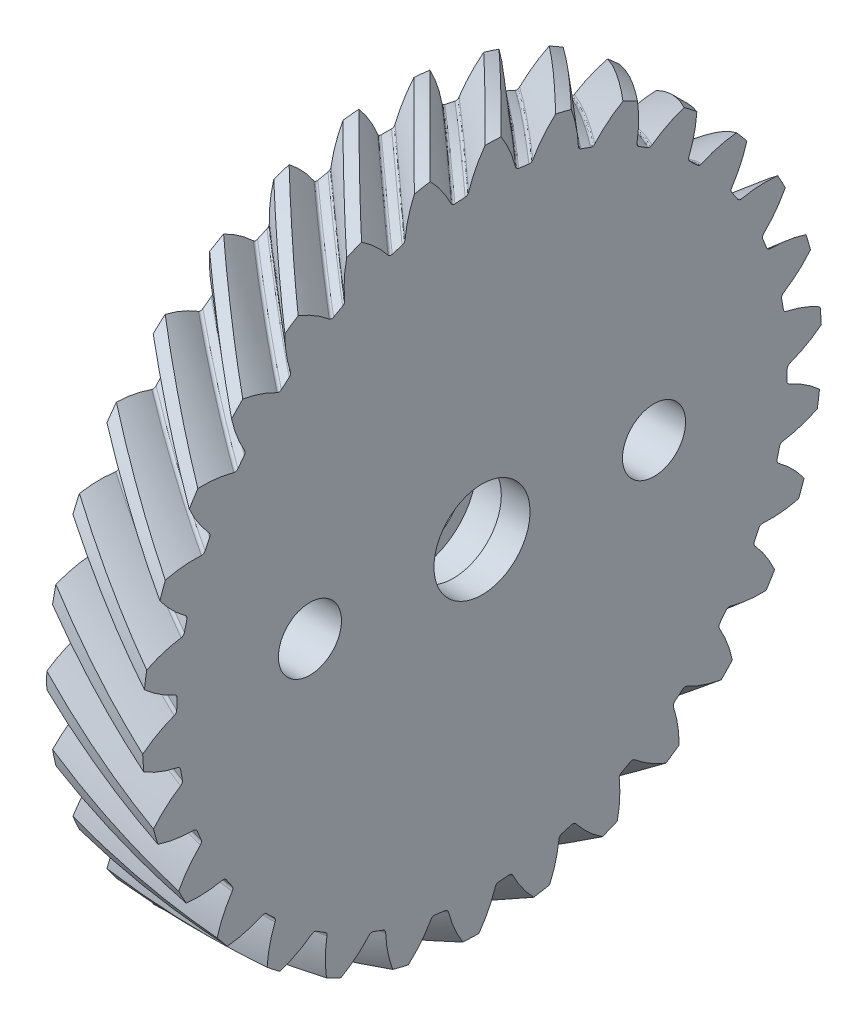
from build123d import *

# Parameters (mm, degrees)
BASPROSKE_W               = 5
BASPROSKE_H               = 17.770562748
TOOTHCUTRH_PITCH          = 111.655738762
TOOTHCUTRH_HEIGHT         = 5
TOOTHCUTRH_RADIUS         = 17.770562748
TOOTHCUTRH_START_ANGLE    = -90
TEETHCUTSRH_COUNT         = 30
TEETHCUTSRH_ANGLE         = 348
BORSKE_R                  = 2.5126
BORE_DEPTH                = 62.5000025
CUT_EXTRUDE1_START        = -1.5
SKETCH5_R                 = 3.2198
CUT_EXTRUDE1_DEPTH        = 2
BOSS_EXTRUDE3_DEPTH       = 12.5
FILLET1_R                 = 10
M2_H4_T_INSERT_REACH      = 28.562
M2_H4_T_INSERT_END_RADIUS = 16.5
SKETCH3_R                 = 1.65
SKETCH8_R                 = 2.5126
CUT_EXTRUDE3_DEPTH        = 26.623930397


with BuildPart() as part:
    # BasProSke → Base-Revolve (revolve)
    with BuildSketch(Plane(origin=(0, 0, 0), x_dir=(1, 0, 0), z_dir=(0, 1, 0)), mode=Mode.PRIVATE) as base_revolve_sk:
        with Locations((2.5, 8.885281374)):
            Rectangle(BASPROSKE_W, BASPROSKE_H)
    revolve(base_revolve_sk.sketch.rotate(Axis((-10, 0, 0), (1, 0, 0)), 180), axis=Axis((-10, 0, 0), (1, 0, 0)))

    # ToothCutRH: sweep along a helix
    with BuildLine() as toothcutrh_path:
        add(Helix(TOOTHCUTRH_PITCH, TOOTHCUTRH_HEIGHT, TOOTHCUTRH_RADIUS, center=(0, 0, 0), direction=(1, 0, 0), mode=Mode.PRIVATE).rotate(Axis((0, 0, 0), (1, 0, 0)), TOOTHCUTRH_START_ANGLE))
    # TooCutSkeRH → ToothCutRH (sweep, cut)
    with BuildSketch(Plane(origin=(0, 0, 0), x_dir=(0, 0, -1), z_dir=(1, 0, 0))):
        with BuildLine():
            ThreePointArc((0.269502427, 15.968288667), (0, 15.970562748), (-0.269502427, 15.968288667))
            ThreePointArc((-0.269502427, 15.968288667), (-0.383742146, 16.001588482), (-0.459132324, 16.093653199))
            ThreePointArc((-0.459132324, 16.093653199), (-1.068057994, 17.226917629), (-1.904576236, 18.204320295))
            ThreePointArc((-1.904576236, 18.204320295), (0, 18.303679631), (1.904576236, 18.204320295))
            ThreePointArc((1.904576236, 18.204320295), (1.068057994, 17.226917629), (0.459132324, 16.093653199))
            ThreePointArc((0.459132324, 16.093653199), (0.383742146, 16.001588482), (0.269502427, 15.968288667))
        make_face()
    toothcutrh = sweep(path=toothcutrh_path.line, is_frenet=True, mode=Mode.SUBTRACT)

    # TeethCutsRH: ToothCutRH ×30 about axis
    teethcutsrh_axis = Axis((-10, 0, 0), (1, 0, 0))
    for i in range(1, TEETHCUTSRH_COUNT):
        add(toothcutrh.rotate(teethcutsrh_axis, i * TEETHCUTSRH_ANGLE / (TEETHCUTSRH_COUNT - 1)), mode=Mode.SUBTRACT)

    # BorSke → Bore (cut, symmetric)
    with BuildSketch(Plane(origin=(0, 0, 0), x_dir=(0, 0, -1), z_dir=(1, 0, 0))):
        with Locations(Location((0, 0, 0), (0, 0, 180))):
            Circle(BORSKE_R)
    extrude(amount=BORE_DEPTH, both=True, mode=Mode.SUBTRACT)

    # Sketch5 → Cut-Extrude1 (cut)
    with BuildSketch(Plane(origin=(5, 0, 0), x_dir=(0, 0, -1), z_dir=(1, 0, 0)).offset(CUT_EXTRUDE1_START)):
        Circle(SKETCH5_R)
    extrude(amount=-CUT_EXTRUDE1_DEPTH, mode=Mode.SUBTRACT)

    # Sketch6 → Boss-Extrude3 (add, symmetric)
    with BuildSketch(Plane.XY):
        with BuildLine():
            Line((0, 10), (-3.6, 10))
            ThreePointArc((-3.6, 10), (-0.224404748, 0), (-3.6, -10))
            Line((-3.6, -10), (0, -10))
            Line((0, -10), (0, 10))
        make_face()
    extrude(amount=BOSS_EXTRUDE3_DEPTH, both=True)

    # Fillet1
    fillet1_edges = [part.edges().sort_by_distance(p)[0] for p in [
        (-1.8, -10, -12.5),
        (-1.8, -10, 12.5),
        (-1.8, 10, -12.5),
        (-1.8, 10, 12.5),
    ]]
    fillet(fillet1_edges, radius=FILLET1_R - 0.0001)  # a hair under: the kernel refuses the full size

    # M2*H4 T-Insert: up to this cylinder (the profile starts outside it)
    m2_h4_t_insert_end = Plane(origin=(-16.724404748, 0, 0), z_dir=(0, 0, -1)) * Cylinder(M2_H4_T_INSERT_END_RADIUS, 109.124, mode=Mode.PRIVATE)
    # Sketch3 → M2*H4 T-Insert (cut, up to the surface)
    with BuildSketch(Plane(origin=(5, 0, 0), x_dir=(0, 0, -1), z_dir=(1, 0, 0)), mode=Mode.PRIVATE) as m2_h4_t_insert_sk1:
        with Locations((-9, 0)):
            Circle(SKETCH3_R)
    m2_h4_t_insert_tool1 = extrude(m2_h4_t_insert_sk1.sketch, amount=-M2_H4_T_INSERT_REACH, mode=Mode.PRIVATE) - m2_h4_t_insert_end
    add(m2_h4_t_insert_tool1.solids().sort_by_distance((5, 0, 9))[0], mode=Mode.SUBTRACT)
    # Sketch3 → M2*H4 T-Insert (cut, up to the surface)
    with BuildSketch(Plane(origin=(5, 0, 0), x_dir=(0, 0, -1), z_dir=(1, 0, 0)), mode=Mode.PRIVATE) as m2_h4_t_insert_sk2:
        with Locations((9, 0)):
            Circle(SKETCH3_R)
    m2_h4_t_insert_tool2 = extrude(m2_h4_t_insert_sk2.sketch, amount=-M2_H4_T_INSERT_REACH, mode=Mode.PRIVATE) - m2_h4_t_insert_end
    add(m2_h4_t_insert_tool2.solids().sort_by_distance((5, 0, -9))[0], mode=Mode.SUBTRACT)

    # Sketch8 → Cut-Extrude3 (cut, through all)
    with BuildSketch(Plane(origin=(0, 0, 0), x_dir=(0, 0, -1), z_dir=(1, 0, 0))):
        with Locations(Location((0, 0, 0), (0, 0, 90))):
            Circle(SKETCH8_R)
    extrude(amount=-CUT_EXTRUDE3_DEPTH, mode=Mode.SUBTRACT)


solid = part.part
